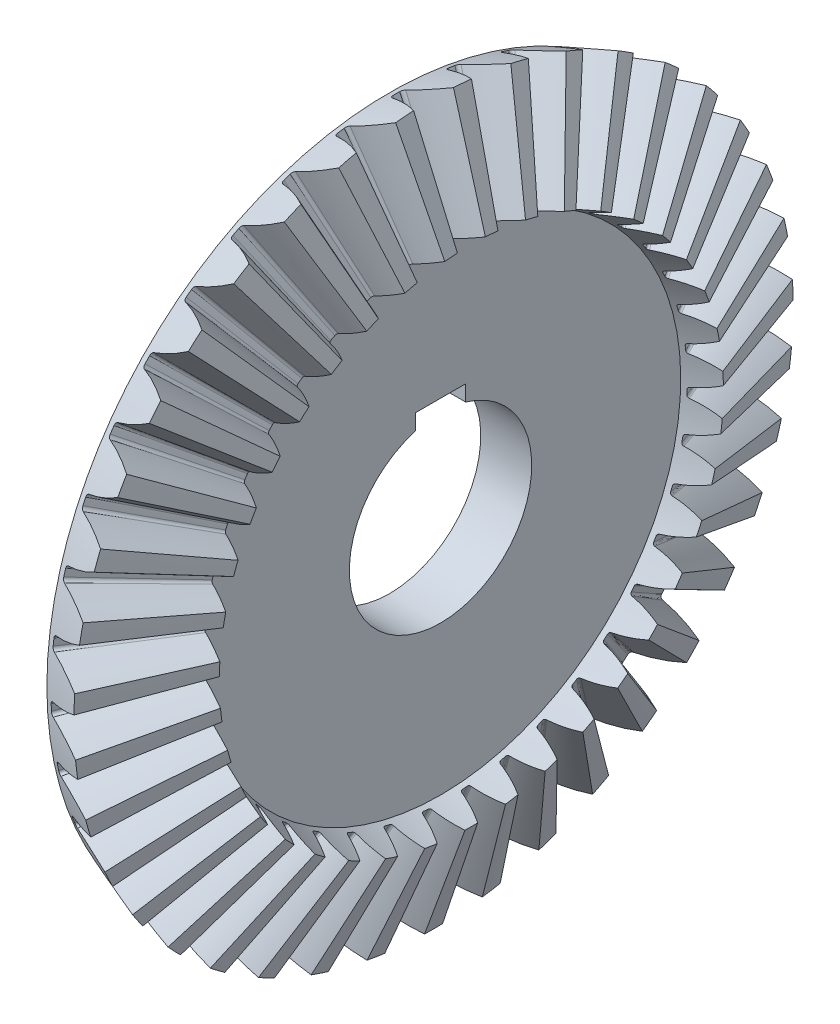
from build123d import *

# Parameters (mm, degrees)
TOOCUTSKE2_R    = 0.0127
TEETHCUTS_COUNT = 39
TEETHCUTS_ANGLE = 350.769230769
HUBSKE_R        = 55
HUB_DEPTH       = 0.0001016
BORSKE_R        = 40
BORE_DEPTH      = 74.74763624
KEYSKE_W        = 22
KEYSKE_H        = 45.4
KEYWAY_DEPTH    = 74.74763624


with BuildPart() as part:
    # BasProSke → Base-Revolve (revolve)
    with BuildSketch(Plane(origin=(0, 0, 0), x_dir=(1, 0, 0), z_dir=(0, 1, 0)), mode=Mode.PRIVATE) as base_revolve_sk:
        Polygon((0, 0), (0, 150.327851774), (19.287731935, 157.74621018), (35.878504497, 110.556552409), (22.360682775, 105.35739023), (22.360682775, 0), align=None)
    revolve(base_revolve_sk.sketch.rotate(Axis((-10, 0, 0), (1, 0, 0)), 180), axis=Axis((-10, 0, 0), (1, 0, 0)))

    # TooCutSke2 → ToothCut section 0
    with BuildSketch(Plane(origin=(9.632420736, -25.044294017, 0), x_dir=(0, 0, 1), z_dir=(-0.3589790780252061, 0.9333456066967762, 0))):
        with Locations((0, 69.765330259)):
            Circle(TOOCUTSKE2_R)
    # TooCutSke → ToothCut section 1
    with BuildSketch(Plane(origin=(9.643865967, 154.037030977, 0), x_dir=(0, 0, -1), z_dir=(-0.358979078025206, 0.9333456066967761, 0))):
        with BuildLine():
            ThreePointArc((-10.415903053, -13.21893078), (0, -13.549865237), (10.415903053, -13.21893078))
            ThreePointArc((10.415903053, -13.21893078), (5.887645344, -3.928908115), (2.954851398, 5.981104936))
            ThreePointArc((2.954851398, 5.981104936), (2.425153424, 6.847252814), (1.465921257, 7.179917422))
            ThreePointArc((1.465921257, 7.179917422), (0, 7.172422337), (-1.465921257, 7.179917422))
            ThreePointArc((-1.465921257, 7.179917422), (-2.425153424, 6.847252814), (-2.954851398, 5.981104936))
            ThreePointArc((-2.954851398, 5.981104936), (-5.887645344, -3.928908115), (-10.415903053, -13.21893078))
        make_face()
    toothcut = loft(mode=Mode.SUBTRACT)

    # TeethCuts: ToothCut ×39 about axis
    teethcuts_axis = Axis((-10, 0, 0), (1, 0, 0))
    for i in range(1, TEETHCUTS_COUNT):
        add(toothcut.rotate(teethcuts_axis, i * TEETHCUTS_ANGLE / (TEETHCUTS_COUNT - 1)), mode=Mode.SUBTRACT)

    # HubSke → Hub (add)
    with BuildSketch(Plane.ZY):
        with Locations(Location((0, 0, 0), (0, 0, 180))):
            Circle(HUBSKE_R)
    extrude(amount=HUB_DEPTH)

    # BorSke → Bore (cut, symmetric)
    with BuildSketch(Plane(origin=(0, 0, 0), x_dir=(0, 0, -1), z_dir=(1, 0, 0))):
        with Locations(Location((0, 0, 0), (0, 0, 180))):
            Circle(BORSKE_R)
    extrude(amount=BORE_DEPTH, both=True, mode=Mode.SUBTRACT)

    # KeySke → Keyway (cut, symmetric)
    with BuildSketch(Plane(origin=(0, 0, 0), x_dir=(0, 0, -1), z_dir=(1, 0, 0))):
        with Locations((0, 22.7)):
            Rectangle(KEYSKE_W, KEYSKE_H)
    extrude(amount=KEYWAY_DEPTH, both=True, mode=Mode.SUBTRACT)


solid = part.part
